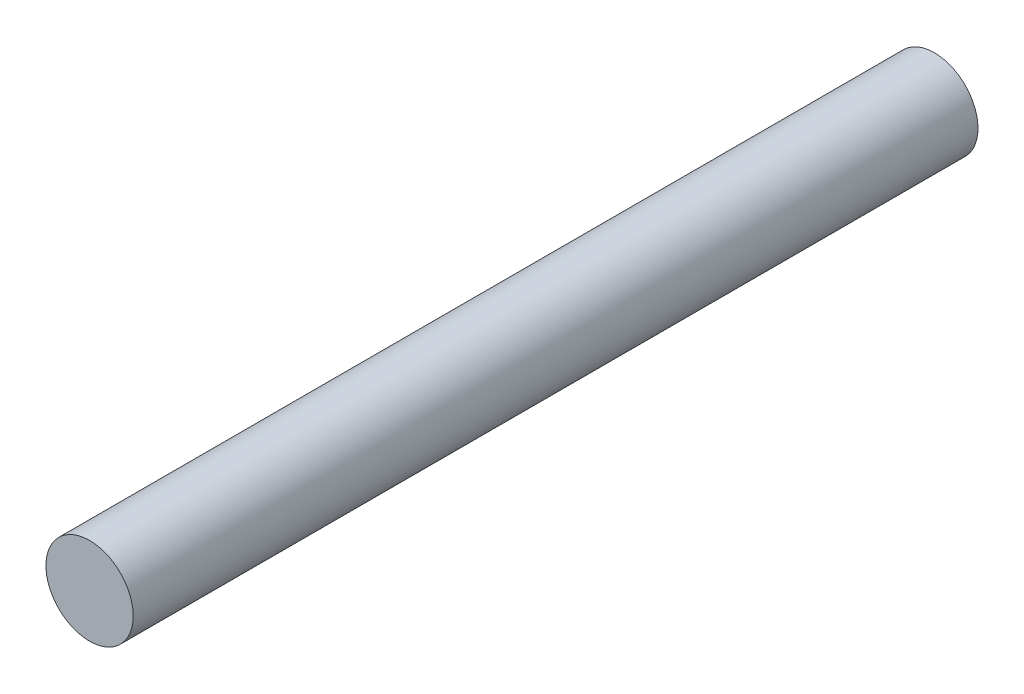
from build123d import *

# Parameters (mm, degrees)
SKETCH_1_R      = 3.1
EXTRUDE_1_DEPTH = 60


with BuildPart() as part:
    # 草图1 → 凸台-拉伸1 (new body)
    with BuildSketch(Plane.XY):
        Circle(SKETCH_1_R)
    extrude(amount=EXTRUDE_1_DEPTH)


solid = part.part
